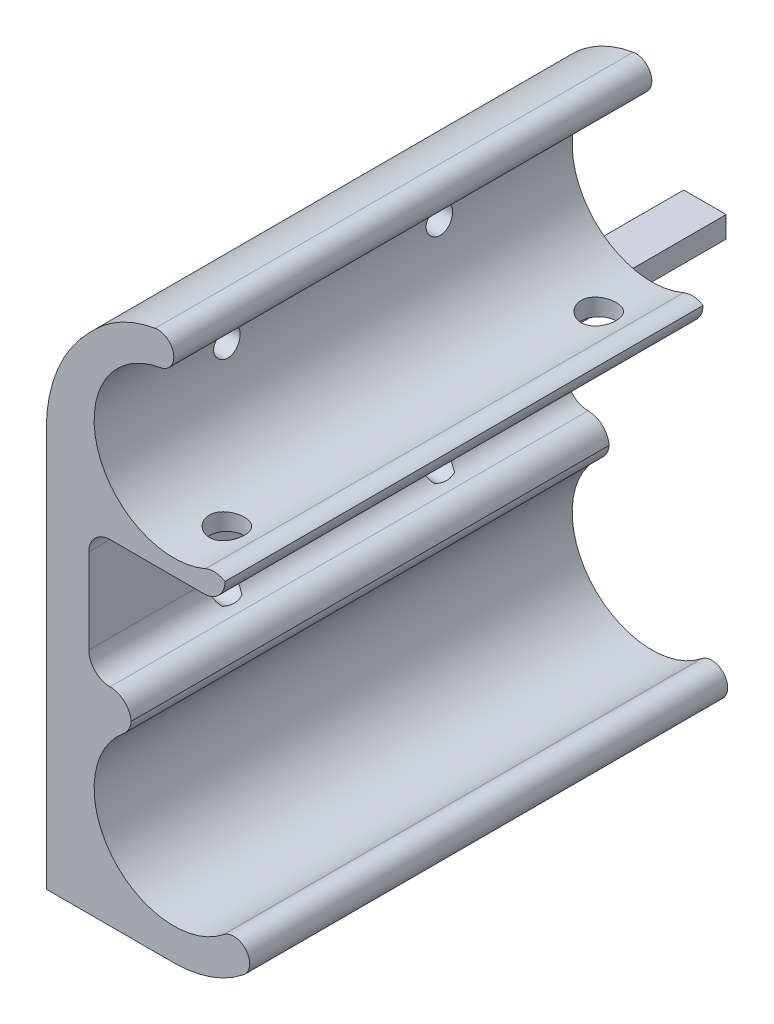
from build123d import *

# Parameters (mm, degrees)
BOSS_EXTRUDE1_DEPTH        = 22.5
M4X0_7_TAPPED_HOLE2_REACH  = 42.528
M4X0_7_TAPPED_HOLE2_BORE_R = 1.65
FILLET2_R                  = 2
FILLET3_START              = -23
FILLET3_DEPTH              = 46
FILLET4_START              = -22.5
FILLET4_DEPTH              = 45
FILLET5_R                  = 2
FILLET7_R                  = 14
CUT_EXTRUDE5_DEPTH         = 5
FILLET8_R                  = 0.5
M3X0_5_TAPPED_HOLE1_D      = 2.5
M3X0_5_TAPPED_HOLE1_DEPTH  = 5
M3X0_5_TAPPED_HOLE1_TIP    = 0.751075774
SKETCH20_W                 = 4
SKETCH20_H                 = 2
BOSS_EXTRUDE3_DEPTH        = 15


with BuildPart() as part:
    # Sketch1 → Boss-Extrude1 (new, symmetric)
    with BuildSketch(Plane.XY):
        with BuildLine():
            Line((7.142207986, -17.288856719), (7.142207986, -22.696678834))
            ThreePointArc((7.142207986, -22.696678834), (3.836331075, -24.774076114), (0, -25.5))
            Line((0, -25.5), (-12, -25.5))
            Line((-12, -25.5), (-12, 17.849242405))
            Line((-12, 17.849242405), (-7.424621202, 22.424621202))
            ThreePointArc((-7.424621202, 22.424621202), (-4.01817604, 24.700735091), (0, 25.5))
            Line((0, 25.5), (0, 22.5))
            ThreePointArc((0, 22.5), (-7.047694656, 12.434848925), (4.820907073, 9.254666677))
            Line((4.820907073, 9.254666677), (4.820907073, 6))
            Line((4.820907073, 6), (-8, 6))
            Line((-8, 6), (-8, -6))
            Line((-8, -6), (-4, -6))
            Line((-4, -6), (-4, -8.65571123))
            ThreePointArc((-4, -8.65571123), (-4.593600768, -20.928645038), (7.142207986, -17.288856719))
        make_face()
    extrude(amount=BOSS_EXTRUDE1_DEPTH, both=True)

    # M4x0.7 Tapped Hole2 bore → M4x0.7 Tapped Hole2 (cut, up to next)
    with BuildSketch(Plane(origin=(0, 6, 0), x_dir=(-1, 0, 0), z_dir=(0, -1, 0)), mode=Mode.PRIVATE) as m4x0_7_tapped_hole2_sk1:
        with Locations((0, -17.5)):
            Circle(M4X0_7_TAPPED_HOLE2_BORE_R)
    m4x0_7_tapped_hole2_tool1 = extrude(m4x0_7_tapped_hole2_sk1.sketch, amount=-M4X0_7_TAPPED_HOLE2_REACH, mode=Mode.PRIVATE) & part.part
    # M4x0.7 Tapped Hole2 bore → M4x0.7 Tapped Hole2 (cut, up to next)
    with BuildSketch(Plane(origin=(0, 6, 0), x_dir=(-1, 0, 0), z_dir=(0, -1, 0)), mode=Mode.PRIVATE) as m4x0_7_tapped_hole2_sk2:
        with Locations((0, 17.5)):
            Circle(M4X0_7_TAPPED_HOLE2_BORE_R)
    m4x0_7_tapped_hole2_tool2 = extrude(m4x0_7_tapped_hole2_sk2.sketch, amount=-M4X0_7_TAPPED_HOLE2_REACH, mode=Mode.PRIVATE) & part.part
    add(m4x0_7_tapped_hole2_tool1.solids().sort_by_distance((0, 6, 17.5))[0], mode=Mode.SUBTRACT)
    add(m4x0_7_tapped_hole2_tool2.solids().sort_by_distance((0, 6, -17.5))[0], mode=Mode.SUBTRACT)

    # Fillet2
    # the kernel refuses this fillet: 2 mm, written as the material it adds along each edge
    with BuildSketch(Plane(origin=(-8, -6, 22.5), x_dir=(0, 1, 0), z_dir=(0, 0, -1)), Plane(origin=(-8, 6, 22.5), x_dir=(1, 0, 0), z_dir=(0, 0, -1))) as fillet2_piece_1:
        with BuildLine():
            CenterArc((FILLET2_R, FILLET2_R), FILLET2_R, 180, 90)
            Line((0, FILLET2_R), (0, 0))
            Line((0, 0), (FILLET2_R, 0))
        make_face()
    extrude(amount=45)
    # the kernel refuses this fillet: 2 mm, written as the material it takes off along each edge
    with BuildSketch(Plane(origin=(-4, -8.65571123, -25.052927903), x_dir=(-0.8120954257724025, -0.5835246519552882, 0), z_dir=(0, 0, 1))) as fillet2_2_piece_1:
        with BuildLine():
            CenterArc((1.028312305, -1.996337733), FILLET2_R, 93.46787904, 50.833289284)
            Line((-0.595878546, -0.829288429), (0, 0))
            ThreePointArc((0, 0), (0.453667193, -0.013733502), (0.907334387, 0))
        make_face()
    extrude(amount=50.105855806, mode=Mode.SUBTRACT)
    with BuildSketch(Plane(origin=(-4, -6, -27.5), x_dir=(0, -1, 0), z_dir=(0, 0, 1)), Plane(origin=(4.820907073, 6, 27.5), x_dir=(0, 1, 0), z_dir=(0, 0, -1))) as fillet2_2_piece_2:
        with BuildLine():
            CenterArc((FILLET2_R, -FILLET2_R), FILLET2_R, 90, 90)
            Line((0, -FILLET2_R), (0, 0))
            Line((0, 0), (FILLET2_R, 0))
        make_face()
    extrude(amount=55, mode=Mode.SUBTRACT)

    # Fillet3: read off the stored shape, not the designer's step
    # Fillet3 outline → Fillet3 (cut)
    with BuildSketch(Plane.XY.offset(FILLET3_START)):
        with BuildLine():
            ThreePointArc((0, 25.5), (-0.878075733, 25.463220489), (-1.75, 25.35313962))
            add(Edge.make_bspline(
                [(-1.75, 25.35313962), (-1.340626415, 25.422336386), (-0.839763435, 25.364052085), (-0.332775331, 25.08288536), (1e-09, 24.544131647), (0, 23.874119673)],
                knots=[0, 0, 0, 0, 0, 0, 0.541960109, 0.541960109, 0.541960109, 0.541960109, 0.541960109, 0.541960109], degree=5, weights=[1, 0.783215957, 0.625176065, 0.525880325, 0.485328737, 0.503521301]))
            Line((0, 23.874119673), (0, 25.5))
        make_face()
        with BuildLine():
            Line((0, 22.5), (0, 23.874119673))
            add(Edge.make_bspline(
                [(0, 23.874119673), (-1e-09, 23.344488498), (-0.216926345, 22.902050344), (-0.555121167, 22.607049118), (-0.918235372, 22.451178186), (-1.25, 22.395099729)],
                knots=[0.541960109, 0.541960109, 0.541960109, 0.541960109, 0.541960109, 0.541960109, 1, 1, 1, 1, 1, 1], degree=5, weights=[0.503521301, 0.518896824, 0.576232456, 0.675528195, 0.816784043, 1]))
            ThreePointArc((-1.25, 22.395099729), (-0.627196952, 22.473728921), (0, 22.5))
        make_face()
    extrude(amount=FILLET3_DEPTH, mode=Mode.SUBTRACT)

    # Fillet4: read off the stored shape, not the designer's step
    # Fillet4 outline → Fillet4 (cut)
    with BuildSketch(Plane.XY.offset(FILLET4_START)):
        with BuildLine():
            ThreePointArc((7.142207986, -17.288856719), (6.182933262, -19.245154446), (4.701839989, -20.843175568))
            add(Edge.make_bspline(
                [(4.701839989, -20.843175568), (5.135113998, -20.494532089), (5.812281829, -20.26945545), (6.615008937, -20.444697489), (7.14219213, -21.142606567), (7.142207986, -22.011783319)],
                knots=[0, 0, 0, 0, 0, 0, 0.676183816, 0.676183816, 0.676183816, 0.676183816, 0.676183816, 0.676183816], degree=5, weights=[1, 0.729526474, 0.550497858, 0.462914153, 0.466775358, 0.562081474]))
            Line((7.142207986, -22.011783319), (7.142207986, -17.288856719))
        make_face()
        with BuildLine():
            Line((7.142207986, -22.696678834), (7.142207986, -22.011783319))
            add(Edge.make_bspline(
                [(7.142207986, -22.011783319), (7.142213818, -22.331484727), (7.059225631, -22.61727017), (6.921863818, -22.854436912), (6.756468906, -23.040519024), (6.582575984, -23.180445796)],
                knots=[0.676183816, 0.676183816, 0.676183816, 0.676183816, 0.676183816, 0.676183816, 1, 1, 1, 1, 1, 1], degree=5, weights=[0.562081474, 0.607722411, 0.674334732, 0.761918437, 0.870473526, 1]))
            ThreePointArc((6.582575984, -23.180445796), (6.866653579, -22.943492218), (7.142207986, -22.696678834))
        make_face()
    extrude(amount=FILLET4_DEPTH, mode=Mode.SUBTRACT)

    # Fillet5
    # the kernel refuses this fillet: 2 mm, written as the material it takes off along each edge
    with BuildSketch(Plane(origin=(4.820907073, 9.254666677, 27.882265511), x_dir=(-0.8503705465795661, -0.5261843151500908, 0), z_dir=(0, 0, -1))) as fillet5_piece_1:
        with BuildLine():
            CenterArc((2.439960365, -1.97929278), FILLET5_R, 98.251994966, 54.607083408)
            Line((0.660185926, -1.066931588), (0.624590437, -1.048684364))
            ThreePointArc((0.624590437, -1.048684364), (0.296078141, -0.554513166), (-0.034014822, -0.021047373))
            Line((-0.034014822, -0.021047373), (0.005741083, 0.039585856))
            ThreePointArc((0.005741083, 0.039585856), (1.076453102, -0.037652075), (2.147165121, 0.039585856))
            Line((2.147165121, 0.039585856), (2.152906205, 0))
        make_face()
    extrude(amount=55.764531023, mode=Mode.SUBTRACT)

    # Fillet7
    fillet7_edges = [part.edges().sort_by_distance(p)[0] for p in [
        (-12, 17.849242405, 0),
    ]]
    fillet(fillet7_edges, radius=FILLET7_R)

    # Sketch17 → Cut-Extrude5 (cut)
    with BuildSketch(Plane.XZ.offset(25.5)):
        Polygon((-12, 7.5), (-10, 9.5), (-10, -9.5), (-12, -7.5), align=None)
    extrude(amount=-CUT_EXTRUDE5_DEPTH, mode=Mode.SUBTRACT)

    # Fillet8
    fillet8_edges = [part.edges().sort_by_distance(p)[0] for p in [
        (-12, -23, -7.5),
        (-12, -23, 7.5),
        (-10, -23, 9.5),
        (-10, -23, -9.5),
    ]]
    fillet(fillet8_edges, radius=FILLET8_R)

    # M3x0.5 Tapped Hole1
    with Locations(Plane.ZY.offset(12)):
        with Locations((-10, 15.1), (-10, -4.9), (10, -4.9), (10, 15.1)):
            Hole(M3X0_5_TAPPED_HOLE1_D / 2, depth=M3X0_5_TAPPED_HOLE1_DEPTH)
            with Locations((0, 0, -(M3X0_5_TAPPED_HOLE1_DEPTH + M3X0_5_TAPPED_HOLE1_TIP / 2))):  # 118° drill point
                Cone(0, M3X0_5_TAPPED_HOLE1_D / 2, M3X0_5_TAPPED_HOLE1_TIP, mode=Mode.SUBTRACT)

    # Sketch20 → Boss-Extrude3 (add)
    with BuildSketch(Plane(origin=(0, 0, -22.5), x_dir=(-1, 0, 0), z_dir=(0, 0, -1))):
        with Locations((10, 0.5)):
            Rectangle(SKETCH20_W, SKETCH20_H)
    extrude(amount=BOSS_EXTRUDE3_DEPTH)


solid = part.part
